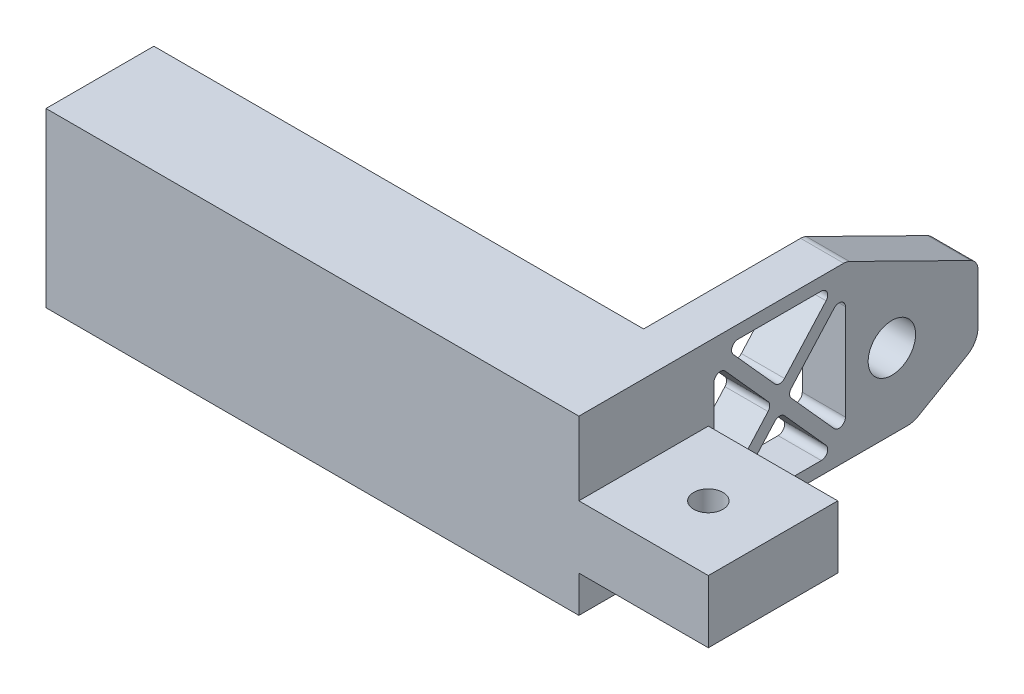
from build123d import *

# Parameters (mm, degrees)
SKETCH1_W             = 92.5
SKETCH1_H             = 40
BOSS_EXTRUDE1_DEPTH   = 10
SKETCH5_R             = 5.5
CUT_EXTRUDE1_DEPTH    = 27
SKETCH6_W             = 30
SKETCH6_H             = 6
BOSS_EXTRUDE5_DEPTH   = 30
SKETCH7_W             = 30
SKETCH7_H             = 30
BOSS_EXTRUDE6_DEPTH   = 8.5
SKETCH4_W             = 25
SKETCH4_H             = 40
SKETCH4_W_2           = 10.25
SKETCH4_H_2           = 25.25
BOSS_EXTRUDE7_DEPTH   = 113.5
FILLET1_R             = 3
CHAMFER1_SIZE         = 15
CHAMFER1_SIZE2        = 30.41699103
FILLET3_R             = 3
CHAMFER3_SIZE         = 15
CHAMFER3_SIZE2        = 8.660254038
FILLET7_R             = 5
M8_TAPPED_HOLE1_D     = 6.8
M8_TAPPED_HOLE1_DEPTH = 22.25
M8_TAPPED_HOLE1_TIP   = 2.042926105
CUT_EXTRUDE2_DEPTH    = 138.329360826
FILLET8_R             = 1.5


with BuildPart() as part:
    # Sketch1 → Boss-Extrude1 (new body)
    with BuildSketch(Plane(origin=(0, 0, 0), x_dir=(0, 0, -1), z_dir=(1, 0, 0))):
        with Locations((10.335365854, 0.129573171)):
            Rectangle(SKETCH1_W, SKETCH1_H)
    extrude(amount=BOSS_EXTRUDE1_DEPTH)

    # Sketch5 → Cut-Extrude1 (cut)
    with BuildSketch(Plane.ZY):
        with Locations((-36.625365854, -2.430426829)):
            Circle(SKETCH5_R)
    extrude(amount=-CUT_EXTRUDE1_DEPTH, mode=Mode.SUBTRACT)

    # Sketch6 → Boss-Extrude5 (add)
    with BuildSketch(Plane(origin=(10, 0, 0), x_dir=(0, 0, -1), z_dir=(1, 0, 0))):
        with Locations((-20.914634146, 0.129573171)):
            Rectangle(SKETCH6_W, SKETCH6_H)
    extrude(amount=BOSS_EXTRUDE5_DEPTH)

    # Sketch7 → Boss-Extrude6 (add)
    with BuildSketch(Plane.XZ.offset(2.870426829)):
        with Locations((25, 20.914634146)):
            Rectangle(SKETCH7_W, SKETCH7_H)
    extrude(amount=BOSS_EXTRUDE6_DEPTH)

    # Sketch4 → Boss-Extrude7 (add)
    with BuildSketch(Plane.ZY):
        with Locations((23.414634146, 0.129573171)):
            Rectangle(SKETCH4_W, SKETCH4_H)
        with Locations((23.414634146, 0.129573171)):
            Rectangle(SKETCH4_W_2, SKETCH4_H_2, mode=Mode.SUBTRACT)
    extrude(amount=BOSS_EXTRUDE7_DEPTH)

    # Fillet1
    fillet1_edges = [part.edges().sort_by_distance(p)[0] for p in [
        (-113.5, -12.495426829, 23.414634146),
        (-113.5, 0.129573171, 28.539634146),
        (-113.5, 12.754573171, 23.414634146),
        (-113.5, 0.129573171, 18.289634146),
    ]]
    fillet(fillet1_edges, radius=FILLET1_R)

    # Chamfer1
    chamfer1_edges = [part.edges().sort_by_distance(p)[0] for p in [
        (5, 20.129573171, -56.585365854),
    ]]
    chamfer1_side = [part.faces().sort_by_distance(p)[0] for p in [
        (5, 0.129573171, -56.585365854),
    ]]
    chamfer(chamfer1_edges, length=CHAMFER1_SIZE, length2=CHAMFER1_SIZE2, reference=chamfer1_side[0])

    # Fillet3
    fillet3_edges = [part.edges().sort_by_distance(p)[0] for p in [
        (5, 20.129573171, -26.168374824),
        (5, 5.129573171, -56.585365854),
    ]]
    fillet(fillet3_edges, radius=FILLET3_R)

    # Chamfer3
    chamfer3_edges = [part.edges().sort_by_distance(p)[0] for p in [
        (5, -19.870426829, -56.585365854),
    ]]
    chamfer3_side = [part.faces().sort_by_distance(p)[0] for p in [
        (-41.568936877, -19.870426829, 15.117291954),
    ]]
    chamfer(chamfer3_edges, length=CHAMFER3_SIZE, length2=CHAMFER3_SIZE2, reference=chamfer3_side[0])

    # Fillet7
    fillet7_edges = [part.edges().sort_by_distance(p)[0] for p in [
        (5, -19.870426829, -41.585365854),
        (5, -11.210172791, -56.585365854),
    ]]
    fillet(fillet7_edges, radius=FILLET7_R)

    # M8 Tapped Hole1
    with Locations(Plane(origin=(0, 3.129573171, 0), x_dir=(1, 0, 0), z_dir=(0, 1, 0))):
        with Locations((25, -20.914634146)):
            Hole(M8_TAPPED_HOLE1_D / 2, depth=M8_TAPPED_HOLE1_DEPTH)
            with Locations((0, 0, -(M8_TAPPED_HOLE1_DEPTH + M8_TAPPED_HOLE1_TIP / 2))):  # 118° drill point
                Cone(0, M8_TAPPED_HOLE1_D / 2, M8_TAPPED_HOLE1_TIP, mode=Mode.SUBTRACT)

    # Sketch9 → Cut-Extrude2 (cut, through all)
    with BuildSketch(Plane(origin=(10, 0, 0), x_dir=(0, 0, -1), z_dir=(1, 0, 0))):
        Polygon((25.857505885, 15.129573171), (12.413914695, 0.129573171), (25.857505885, -14.870426829), (25.857505885, 0.129573171), align=None)
        Polygon((10.621435869, 17.129573171), (23.621435869, 17.129573171), (10.621435869, 2.624520373), (-2.378564131, 17.129573171), align=None)
        Polygon((10.621435869, -2.365374032), (-2.378564131, -16.870426829), (10.621435869, -16.870426829), (23.621435869, -16.870426829), align=None)
        Polygon((-4.614634146, -14.870426829), (-4.614634146, 0.129573171), (-4.614634146, 15.129573171), (8.828957044, 0.129573171), align=None)
    extrude(amount=-CUT_EXTRUDE2_DEPTH, mode=Mode.SUBTRACT)

    # Fillet8
    fillet8_edges = [part.edges().sort_by_distance(p)[0] for p in [
        (5, -14.870426829, 4.614634146),
        (5, 15.129573171, 4.614634146),
        (5, 0.129573171, -8.828957044),
        (5, -16.870426829, 2.378564131),
        (5, -16.870426829, -23.621435869),
        (5, -2.365374032, -10.621435869),
        (5, -14.870426829, -25.857505885),
        (5, 0.129573171, -12.413914695),
        (5, 15.129573171, -25.857505885),
        (5, 2.624520373, -10.621435869),
        (5, 17.129573171, -23.621435869),
        (5, 17.129573171, 2.378564131),
    ]]
    fillet(fillet8_edges, radius=FILLET8_R)


solid = part.part
